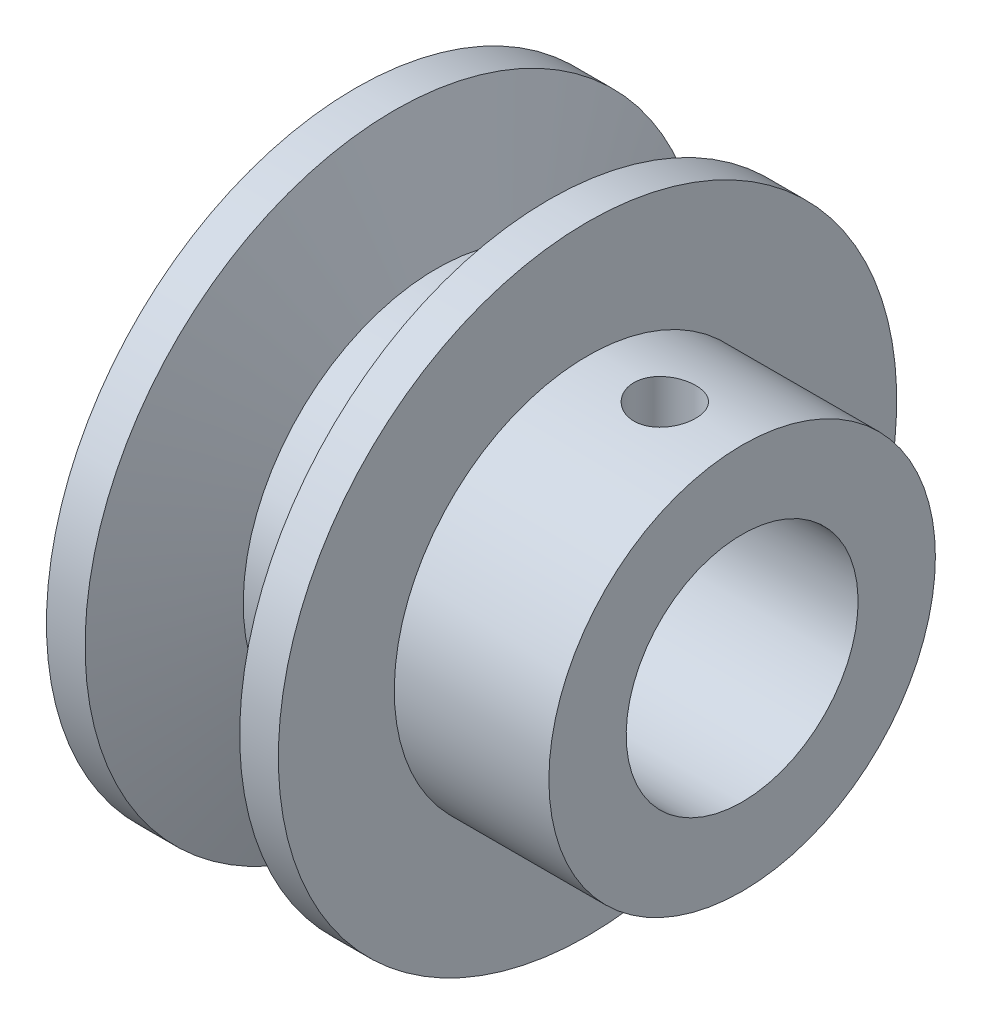
from build123d import *

# Parameters (mm, degrees)
SKETCH2_R           = 12.5
CUT_EXTRUDE1_DEPTH  = 65.031242374
BOSS_EXTRUDE1_START = 20
SKETCH3_R           = 25
BOSS_EXTRUDE1_DEPTH = 20
SKETCH2_2_R         = 12.5
CUT_EXTRUDE2_DEPTH  = 76.498344353
SKETCH5_R           = 20
CUT_EXTRUDE3_DEPTH  = 5
CUT_EXTRUDE3_DRAFT  = -45
SKETCH6_R           = 15
CUT_EXTRUDE4_DEPTH  = 73.284161474
CUT_EXTRUDE5_REACH  = 93.241
SKETCH10_R          = 4


with BuildPart() as part:
    # Sketch1 → Revolve1 (revolve)
    with BuildSketch(Plane.XY):
        Polygon((0, 0), (0, 40), (5, 40), (10.459553514, 25), (19.540446486, 25), (25, 40), (30, 40), (30, 0), align=None)
    revolve(axis=Axis((0, 0, 0), (1, 0, 0)))

    # Sketch2 → Cut-Extrude1 (cut, through all)
    with BuildSketch(Plane.ZY):
        Circle(SKETCH2_R)
    extrude(amount=-CUT_EXTRUDE1_DEPTH, mode=Mode.SUBTRACT)

    # Sketch3 → Boss-Extrude1 (add)
    with BuildSketch(Plane(origin=(30, 0, 0), x_dir=(0, 0, -1), z_dir=(1, 0, 0)).offset(BOSS_EXTRUDE1_START)):
        Circle(SKETCH3_R)
    extrude(amount=-BOSS_EXTRUDE1_DEPTH)

    # Sketch2<2> → Cut-Extrude2 (cut, through all)
    with BuildSketch(Plane.ZY):
        Circle(SKETCH2_2_R)
    extrude(amount=-CUT_EXTRUDE2_DEPTH, mode=Mode.SUBTRACT)


with BuildPart() as cut_extrude3_tool:
    # Sketch5 → Cut-Extrude3 (with draft: the straight prism first)
    with BuildSketch(Plane.ZY):
        Circle(SKETCH5_R)
    extrude(amount=-CUT_EXTRUDE3_DEPTH)
    # Cut-Extrude3: the draft: its side faces are tilted about the plane it starts from
    cut_extrude3_sides = [cut_extrude3_tool.faces().sort_by_distance(p)[0] for p in [
        (2.5, 0, -20),
    ]]
    draft(cut_extrude3_sides, Plane.ZY, CUT_EXTRUDE3_DRAFT)


with BuildPart() as part_1:
    add(part.part)

    # Cut-Extrude3: cut by cut_extrude3_tool
    add(cut_extrude3_tool.part, mode=Mode.SUBTRACT)

    # Sketch6 → Cut-Extrude4 (cut, through all)
    with BuildSketch(Plane.ZY.offset(-5)):
        Circle(SKETCH6_R)
    extrude(amount=-CUT_EXTRUDE4_DEPTH, mode=Mode.SUBTRACT)

    # Sketch10 → Cut-Extrude5 (cut, up to next)
    with BuildSketch(Plane(origin=(0, 25, 0), x_dir=(1, 0, 0), z_dir=(0, 1, 0)), mode=Mode.PRIVATE) as cut_extrude5_sk1:
        with Locations((40, 0)):
            Circle(SKETCH10_R)
    cut_extrude5_tool1 = extrude(cut_extrude5_sk1.sketch, amount=-CUT_EXTRUDE5_REACH, mode=Mode.PRIVATE) & part_1.part
    add(cut_extrude5_tool1.solids().sort_by_distance((40, 25, 0))[0], mode=Mode.SUBTRACT)


solid = part_1.part
